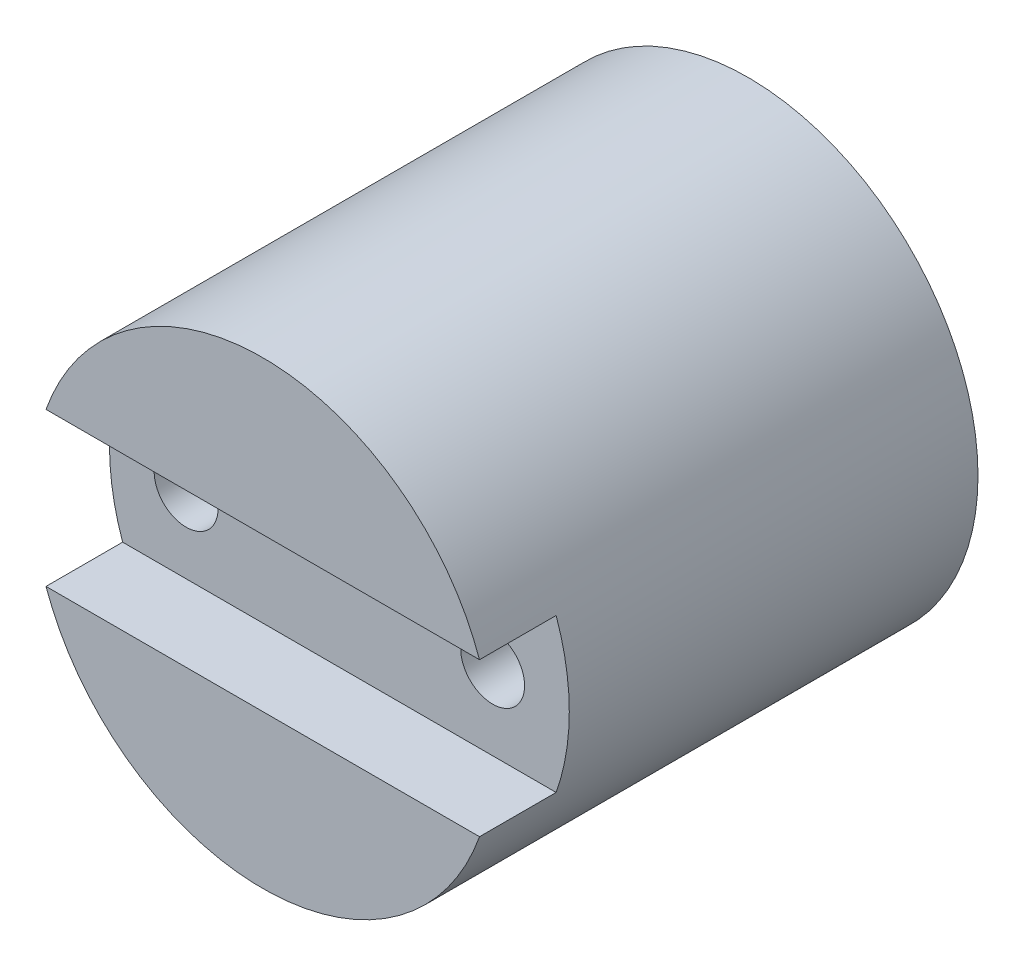
from build123d import *

# Parameters (mm, degrees)
SKETCH1_R           = 9
BODY_DEPTH          = 19
SKETCH2_R           = 4
BORE_DEPTH          = 12
SKETCH3_W           = 1.5
SKETCH3_H           = 9
BORE_FLAT_DEPTH     = 12
SKETCH4_R           = 3
MAGNET_POCKET_DEPTH = 3
SKETCH5_W           = 22
SKETCH5_H           = 6
ARM_SLOT_DEPTH      = 3
SKETCH6_R           = 1.25
ARM_SCREWS_DEPTH    = 6


with BuildPart() as part:
    # Sketch1 → Body (new body)
    with BuildSketch(Plane.XY):
        Circle(SKETCH1_R)
    extrude(amount=BODY_DEPTH)

    # Sketch2 → Bore (cut)
    with BuildSketch(Plane.XY):
        Circle(SKETCH2_R)
    extrude(amount=BORE_DEPTH, mode=Mode.SUBTRACT)

    # Sketch3 → Bore_flat (add)
    with BuildSketch(Plane.XY):
        with Locations((3.95, 0)):
            Rectangle(SKETCH3_W, SKETCH3_H)
    extrude(amount=BORE_FLAT_DEPTH)

    # Sketch4 → Magnet_pocket (cut)
    with BuildSketch(Plane.XY.offset(12)):
        Circle(SKETCH4_R)
    extrude(amount=MAGNET_POCKET_DEPTH, mode=Mode.SUBTRACT)

    # Sketch5 → Arm_slot (cut)
    with BuildSketch(Plane.XY.offset(16)):
        Rectangle(SKETCH5_W, SKETCH5_H)
    extrude(amount=ARM_SLOT_DEPTH, mode=Mode.SUBTRACT)

    # Sketch6 → Arm_screws (cut)
    with BuildSketch(Plane.XY.offset(10)):
        with Locations((-6, 0)):
            Circle(SKETCH6_R)
        with Locations((6, 0)):
            Circle(SKETCH6_R)
    extrude(amount=ARM_SCREWS_DEPTH, mode=Mode.SUBTRACT)


solid = part.part
